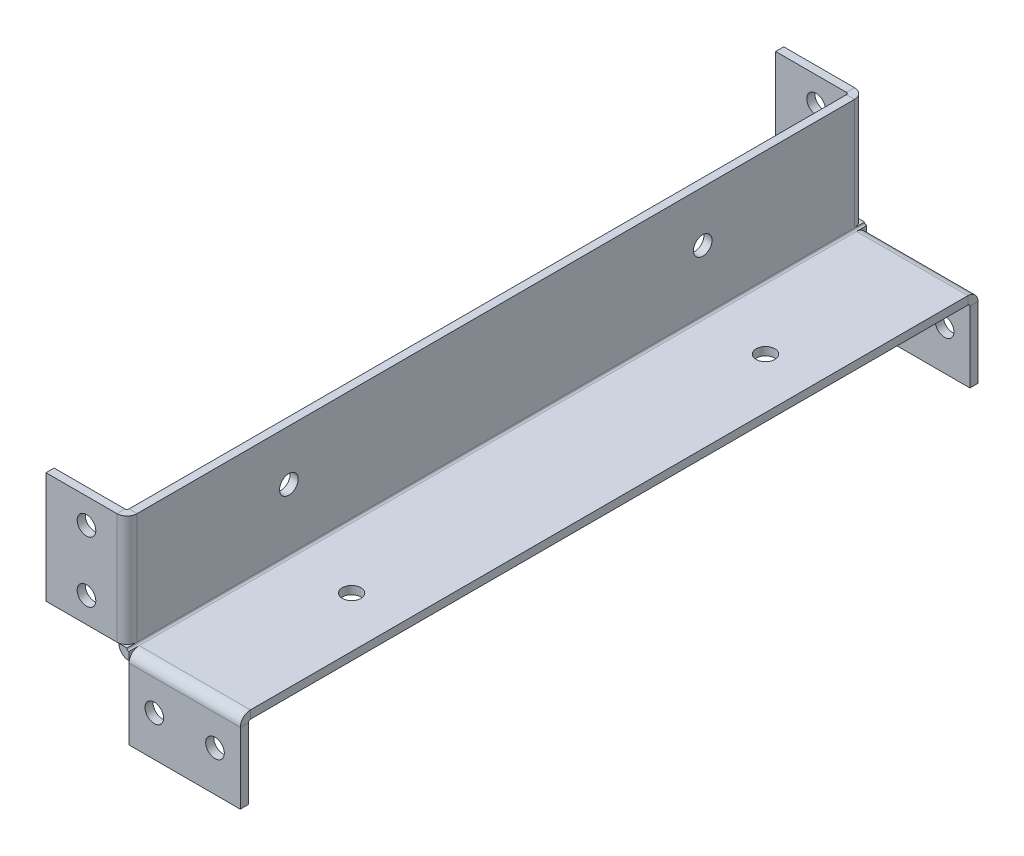
from build123d import *

# Parameters (mm, degrees)
SKETCH1_W                      = 60
SKETCH1_H                      = 364.5
BASE_FLANGE1_DEPTH             = 4
EDGE_FLANGE1_STRIP_W           = 18
EDGE_FLANGE1_STRIP_H           = 4
EDGE_FLANGE1_STRIP_CUT_DEPTH   = 364.5
EDGE_FLANGE1_DEPTH             = 364.5
EDGE_FLANGE2_STRIP_W           = 18
EDGE_FLANGE2_STRIP_H           = 4
EDGE_FLANGE2_STRIP_CUT_DEPTH   = 55
EDGE_FLANGE2_STRIP_2_W         = 18
EDGE_FLANGE2_STRIP_2_H         = 4
EDGE_FLANGE2_STRIP_CUT_2_DEPTH = 55
EDGE_FLANGE2_STRIP_3_W         = 18
EDGE_FLANGE2_STRIP_3_H         = 4
EDGE_FLANGE2_STRIP_CUT_3_DEPTH = 55
EDGE_FLANGE2_STRIP_4_W         = 18
EDGE_FLANGE2_STRIP_4_H         = 4
EDGE_FLANGE2_STRIP_CUT_4_DEPTH = 55
EDGE_FLANGE2_DEPTH             = 55
EDGE_FLANGE2_BEND_DEPTH        = 55
EDGE_FLANGE2_BEND_2_DEPTH      = 55
EDGE_FLANGE2_BEND_3_DEPTH      = 55
SKETCH18_R                     = 4.6
EXTRUDE1_DEPTH                 = 376.254913359
SKETCH19_R                     = 4.6
EXTRUDE2_DEPTH                 = 4
SKETCH20_R                     = 4.6
EXTRUDE3_DEPTH                 = 4


# Sheet-metal steps are written as plain solids
with BuildPart() as part:
    # Sketch1 → Base-Flange1 (new body)
    with BuildSketch(Plane(origin=(0, 0, 0), x_dir=(1, 0, 0), z_dir=(0, 1, 0))):
        Rectangle(SKETCH1_W, SKETCH1_H)
    extrude(amount=BASE_FLANGE1_DEPTH)

    # Edge-Flange1 strip (across the edge) → Edge-Flange1 strip cut (cut)
    with BuildSketch(Plane(origin=(-30, 4, -182.25), x_dir=(1, 0, 0), z_dir=(0, 0, 1))):
        with Locations((-4, -2)):
            Rectangle(EDGE_FLANGE1_STRIP_W, EDGE_FLANGE1_STRIP_H)
    extrude(amount=EDGE_FLANGE1_STRIP_CUT_DEPTH, mode=Mode.SUBTRACT)

    # Edge-Flange1 section (across the edge) → Edge-Flange1 (add)
    with BuildSketch(Plane(origin=(-30, 4, -182.25), x_dir=(1, 0, 0), z_dir=(0, 0, 1))):
        with BuildLine():
            Line((0, 1), (0, 56))
            Line((0, 56), (4, 56))
            Line((4, 56), (4, 1))
            ThreePointArc((4, 1), (4.292893219, 0.292893219), (5, 0))
            Line((5, 0), (5, -4))
            ThreePointArc((5, -4), (1.464466094, -2.535533906), (0, 1))
        make_face()
    extrude(amount=EDGE_FLANGE1_DEPTH)

    # Edge-Flange2 strip (across the edge) → Edge-Flange2 strip cut (cut)
    with BuildSketch(Plane(origin=(-30, 5, 182.25), x_dir=(0, 0, -1), z_dir=(0, 1, 0))):
        with Locations((-4, -2)):
            Rectangle(EDGE_FLANGE2_STRIP_W, EDGE_FLANGE2_STRIP_H)
    extrude(amount=EDGE_FLANGE2_STRIP_CUT_DEPTH, mode=Mode.SUBTRACT)

    # Edge-Flange2 strip 2 (across the edge) → Edge-Flange2 strip cut 2 (cut)
    with BuildSketch(Plane(origin=(30, 0, 182.25), x_dir=(0, 0, -1), z_dir=(-1, 0, 0))):
        with Locations((-4, -2)):
            Rectangle(EDGE_FLANGE2_STRIP_2_W, EDGE_FLANGE2_STRIP_2_H)
    extrude(amount=EDGE_FLANGE2_STRIP_CUT_2_DEPTH, mode=Mode.SUBTRACT)

    # Edge-Flange2 strip 3 (across the edge) → Edge-Flange2 strip cut 3 (cut)
    with BuildSketch(Plane(origin=(-30, 60, -182.25), x_dir=(0, 0, 1), z_dir=(0, -1, 0))):
        with Locations((-4, -2)):
            Rectangle(EDGE_FLANGE2_STRIP_3_W, EDGE_FLANGE2_STRIP_3_H)
    extrude(amount=EDGE_FLANGE2_STRIP_CUT_3_DEPTH, mode=Mode.SUBTRACT)

    # Edge-Flange2 strip 4 (across the edge) → Edge-Flange2 strip cut 4 (cut)
    with BuildSketch(Plane(origin=(-25, 0, -182.25), x_dir=(0, 0, 1), z_dir=(1, 0, 0))):
        with Locations((-4, -2)):
            Rectangle(EDGE_FLANGE2_STRIP_4_W, EDGE_FLANGE2_STRIP_4_H)
    extrude(amount=EDGE_FLANGE2_STRIP_CUT_4_DEPTH, mode=Mode.SUBTRACT)

    # Edge-Flange2 section (across the edge) → Edge-Flange2 (add)
    with BuildSketch(Plane(origin=(-30, 5, 182.25), x_dir=(0, 0, -1), z_dir=(0, 1, 0))):
        with BuildLine():
            Line((0, 1), (0, 36))
            Line((0, 36), (4, 36))
            Line((4, 36), (4, 1))
            ThreePointArc((4, 1), (4.292893219, 0.292893219), (5, 0))
            Line((5, 0), (5, -4))
            ThreePointArc((5, -4), (1.464466094, -2.535533906), (0, 1))
        make_face()
    extrude(amount=EDGE_FLANGE2_DEPTH)

    # Edge-Flange2 section 2 (across the edge) → Edge-Flange2 bend (add)
    with BuildSketch(Plane(origin=(30, 0, 182.25), x_dir=(0, 0, -1), z_dir=(-1, 0, 0))):
        with BuildLine():
            Line((0, 1), (0, 36))
            Line((0, 36), (4, 36))
            Line((4, 36), (4, 1))
            ThreePointArc((4, 1), (4.292893219, 0.292893219), (5, 0))
            Line((5, 0), (5, -4))
            ThreePointArc((5, -4), (1.464466094, -2.535533906), (0, 1))
        make_face()
    extrude(amount=EDGE_FLANGE2_BEND_DEPTH)

    # Edge-Flange2 section 3 (across the edge) → Edge-Flange2 bend 2 (add)
    with BuildSketch(Plane(origin=(-30, 60, -182.25), x_dir=(0, 0, 1), z_dir=(0, -1, 0))):
        with BuildLine():
            Line((0, 1), (0, 36))
            Line((0, 36), (4, 36))
            Line((4, 36), (4, 1))
            ThreePointArc((4, 1), (4.292893219, 0.292893219), (5, 0))
            Line((5, 0), (5, -4))
            ThreePointArc((5, -4), (1.464466094, -2.535533906), (0, 1))
        make_face()
    extrude(amount=EDGE_FLANGE2_BEND_2_DEPTH)

    # Edge-Flange2 section 4 (across the edge) → Edge-Flange2 bend 3 (add)
    with BuildSketch(Plane(origin=(-25, 0, -182.25), x_dir=(0, 0, 1), z_dir=(1, 0, 0))):
        with BuildLine():
            Line((0, 1), (0, 36))
            Line((0, 36), (4, 36))
            Line((4, 36), (4, 1))
            ThreePointArc((4, 1), (4.292893219, 0.292893219), (5, 0))
            Line((5, 0), (5, -4))
            ThreePointArc((5, -4), (1.464466094, -2.535533906), (0, 1))
        make_face()
    extrude(amount=EDGE_FLANGE2_BEND_3_DEPTH)

    # Sketch18 → Extrude1 (cut, through all)
    with BuildSketch(Plane.XY.offset(182.25)):
        with Locations((-46, 47.5)):
            Circle(SKETCH18_R)
        with Locations((-46, 17.5)):
            Circle(SKETCH18_R)
        with Locations((-12.5, -16)):
            Circle(SKETCH18_R)
        with Locations((17.5, -16)):
            Circle(SKETCH18_R)
    extrude(amount=-EXTRUDE1_DEPTH, mode=Mode.SUBTRACT)

    # Sketch19 → Extrude2 (cut)
    with BuildSketch(Plane(origin=(-26, 0, 0), x_dir=(0, 0, -1), z_dir=(1, 0, 0))):
        with Locations(Location((-102.25, 35, 0), (0, 0, 90))):
            Circle(SKETCH19_R)
        with Locations(Location((102.25, 35, 0), (0, 0, 90))):
            Circle(SKETCH19_R)
    extrude(amount=-EXTRUDE2_DEPTH, mode=Mode.SUBTRACT)

    # Sketch20 → Extrude3 (cut)
    with BuildSketch(Plane(origin=(0, 4, 0), x_dir=(1, 0, 0), z_dir=(0, 1, 0))):
        with Locations(Location((5, 102.25, 0), (0, 0, 270))):
            Circle(SKETCH20_R)
        with Locations(Location((5, -102.25, 0), (0, 0, 270))):
            Circle(SKETCH20_R)
    extrude(amount=-EXTRUDE3_DEPTH, mode=Mode.SUBTRACT)


solid = part.part
